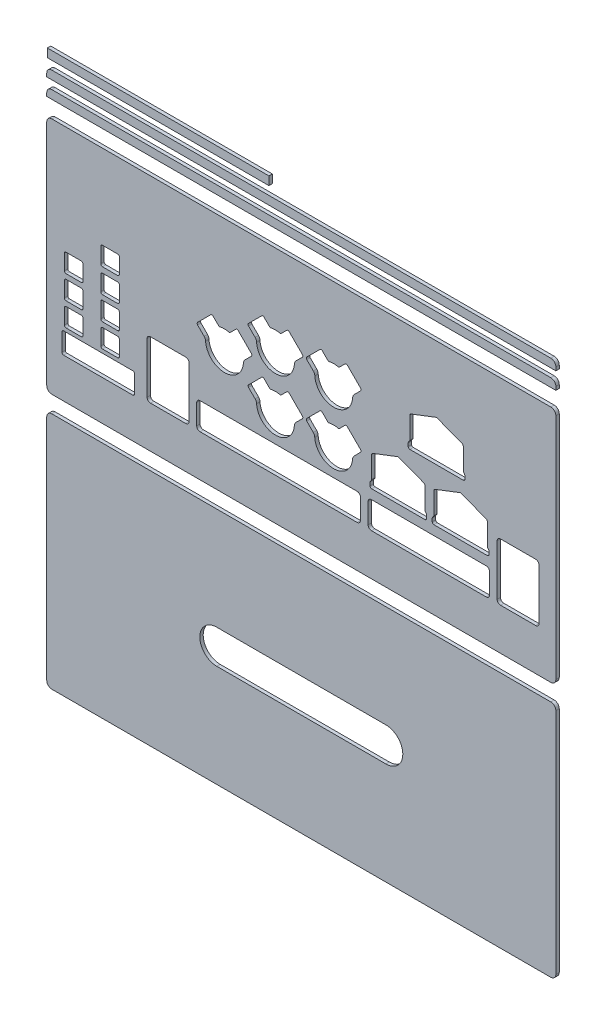
from build123d import *

# Parameters (mm, degrees)
SKETCH_1_W             = 301
SKETCH_1_H             = 141
SKETCH_1_W_2           = 11
SKETCH_1_H_2           = 11
SKETCH_1_W_3           = 42.882009629
SKETCH_1_H_3           = 12.463384351
EXTRUDE_1_DEPTH        = 2
FILLET_1_R             = 3
FILLET_2_R             = 1
SKETCH_2_W             = 301
SKETCH_2_H             = 5
EXTRUDE_2_DEPTH        = 2
FILLET_3_R             = 3
PATTERN_LINEAR_1_COUNT = 2
PATTERN_LINEAR_1_PITCH = 10
SKETCH_3_W             = 131
SKETCH_3_H             = 5
EXTRUDE_3_DEPTH        = 2
SKETCH_4_W             = 301
SKETCH_4_H             = 141
EXTRUDE_4_DEPTH        = 2
FILLET_4_R             = 3
CUT_EXTRUDE_1_DEPTH    = 2


with BuildPart() as part:
    # 草图1 → 凸台-拉伸1 (new body)
    with BuildSketch(Plane.XY):
        with Locations((145.5, 65.5)):
            Rectangle(SKETCH_1_W, SKETCH_1_H)
        with BuildLine():
            Line((107.479342602, 83.3954791), (103.152633216, 79.068769714))
            ThreePointArc((103.152633216, 79.068769714), (100.048889892, 79.525854826), (96.945146567, 79.068769714))
            Line((96.945146567, 79.068769714), (92.630133634, 83.383782646))
            Line((92.630133634, 83.383782646), (83.501399592, 74.255048604))
            Line((83.501399592, 74.255048604), (88.051647854, 69.704800341))
            ThreePointArc((88.051647854, 69.704800341), (88.68925935, 68.747618373), (88.908844178, 67.618668312))
            ThreePointArc((88.908844178, 67.618668312), (100.084096134, 57.15569059), (111.270007089, 67.607272058))
            ThreePointArc((111.270007089, 67.607272058), (111.532715847, 68.742609725), (112.190132556, 69.704800341))
            Line((112.190132556, 69.704800341), (116.680076959, 74.194744744))
            Line((116.680076959, 74.194744744), (107.479342602, 83.3954791))
        make_face(mode=Mode.SUBTRACT)
        with BuildLine():
            Line((137.61695402, 97.935247029), (133.290244634, 93.608537643))
            ThreePointArc((133.290244634, 93.608537643), (130.186501309, 94.065622755), (127.082757985, 93.608537643))
            Line((127.082757985, 93.608537643), (122.767745052, 97.923550576))
            Line((122.767745052, 97.923550576), (113.639011009, 88.794816533))
            Line((113.639011009, 88.794816533), (118.189259272, 84.24456827))
            ThreePointArc((118.189259272, 84.24456827), (118.826870768, 83.287386303), (119.046455596, 82.158436241))
            ThreePointArc((119.046455596, 82.158436241), (130.221707552, 71.695458519), (141.407618507, 82.147039988))
            ThreePointArc((141.407618507, 82.147039988), (141.670327265, 83.282377655), (142.327743974, 84.24456827))
            Line((142.327743974, 84.24456827), (146.817688376, 88.734512673))
            Line((146.817688376, 88.734512673), (137.61695402, 97.935247029))
        make_face(mode=Mode.SUBTRACT)
        with BuildLine():
            Line((172.054755422, 97.935247029), (167.728046035, 93.608537643))
            ThreePointArc((167.728046035, 93.608537643), (164.624302711, 94.065622755), (161.520559387, 93.608537643))
            Line((161.520559387, 93.608537643), (157.205546454, 97.923550576))
            Line((157.205546454, 97.923550576), (148.076812411, 88.794816533))
            Line((148.076812411, 88.794816533), (152.627060674, 84.24456827))
            ThreePointArc((152.627060674, 84.24456827), (153.26467217, 83.287386303), (153.484256998, 82.158436241))
            ThreePointArc((153.484256998, 82.158436241), (164.659508954, 71.695458519), (175.845419909, 82.147039988))
            ThreePointArc((175.845419909, 82.147039988), (176.108128666, 83.282377655), (176.765545376, 84.24456827))
            Line((176.765545376, 84.24456827), (181.255489778, 88.734512673))
            Line((181.255489778, 88.734512673), (172.054755422, 97.935247029))
        make_face(mode=Mode.SUBTRACT)
        with BuildLine():
            Line((172.008536395, 66.461273637), (167.681827008, 62.13456425))
            ThreePointArc((167.681827008, 62.13456425), (164.578083684, 62.591649363), (161.474340359, 62.13456425))
            Line((161.474340359, 62.13456425), (157.159327427, 66.449577183))
            Line((157.159327427, 66.449577183), (148.030593384, 57.32084314))
            Line((148.030593384, 57.32084314), (152.580841647, 52.770594878))
            ThreePointArc((152.580841647, 52.770594878), (153.218453142, 51.81341291), (153.43803797, 50.684462848))
            ThreePointArc((153.43803797, 50.684462848), (164.613289926, 40.221485126), (175.799200881, 50.673066595))
            ThreePointArc((175.799200881, 50.673066595), (176.061909639, 51.808404262), (176.719326348, 52.770594878))
            Line((176.719326348, 52.770594878), (181.209270751, 57.26053928))
            Line((181.209270751, 57.26053928), (172.008536395, 66.461273637))
        make_face(mode=Mode.SUBTRACT)
        with BuildLine():
            Line((137.61695402, 66.461273637), (133.290244634, 62.13456425))
            ThreePointArc((133.290244634, 62.13456425), (130.186501309, 62.591649363), (127.082757985, 62.13456425))
            Line((127.082757985, 62.13456425), (122.767745052, 66.449577183))
            Line((122.767745052, 66.449577183), (113.639011009, 57.32084314))
            Line((113.639011009, 57.32084314), (118.189259272, 52.770594878))
            ThreePointArc((118.189259272, 52.770594878), (118.826870768, 51.81341291), (119.046455596, 50.684462848))
            ThreePointArc((119.046455596, 50.684462848), (130.221707552, 40.221485126), (141.407618507, 50.673066595))
            ThreePointArc((141.407618507, 50.673066595), (141.670327265, 51.808404262), (142.327743974, 52.770594878))
            Line((142.327743974, 52.770594878), (146.817688376, 57.26053928))
            Line((146.817688376, 57.26053928), (137.61695402, 66.461273637))
        make_face(mode=Mode.SUBTRACT)
        Polygon((241.240019748, 90.803703673), (225.444911387, 96.887575353), (209.649803026, 90.803703673), (209.649803026, 77.052080268), (208.690506582, 75.840282178), (208.690506582, 72.632530051), (242.199316192, 72.632530051), (242.199316192, 75.840282178), (241.240019748, 77.052080268), align=None, mode=Mode.SUBTRACT)
        Polygon((218.625141178, 59.339189893), (202.830032817, 65.423061573), (187.034924456, 59.339189893), (187.034924456, 45.587566488), (186.075628012, 44.375768398), (186.075628012, 41.16801627), (219.584437622, 41.16801627), (219.584437622, 44.375768398), (218.625141178, 45.587566488), align=None, mode=Mode.SUBTRACT)
        Polygon((255.450830995, 59.339189893), (239.655722634, 65.423061573), (223.860614273, 59.339189893), (223.860614273, 45.587566488), (222.901317829, 44.375768398), (222.901317829, 41.16801627), (256.410127439, 41.16801627), (256.410127439, 44.375768398), (255.450830995, 45.587566488), align=None, mode=Mode.SUBTRACT)
        with Locations((32.437030163, 66.470141032)):
            Rectangle(SKETCH_1_W_2, SKETCH_1_H_2, mode=Mode.SUBTRACT)
        with BuildLine():
            Line((56.30337663, 53.628236384), (77.135061372, 53.628236384))
            ThreePointArc((77.135061372, 53.628236384), (78.549274934, 53.042449946), (79.135061372, 51.628236384))
            Line((79.135061372, 51.628236384), (79.135061372, 21.643814676))
            ThreePointArc((79.135061372, 21.643814676), (78.549274934, 20.229601113), (77.135061372, 19.643814676))
            Line((77.135061372, 19.643814676), (56.30337663, 19.643814676))
            ThreePointArc((56.30337663, 19.643814676), (54.889163068, 20.229601113), (54.30337663, 21.643814676))
            Line((54.30337663, 21.643814676), (54.30337663, 51.628236384))
            ThreePointArc((54.30337663, 51.628236384), (54.889163068, 53.042449946), (56.30337663, 53.628236384))
        make_face(mode=Mode.SUBTRACT)
        with BuildLine():
            Line((85.64105795, 35.56703416), (178.463172629, 35.56703416))
            ThreePointArc((178.463172629, 35.56703416), (179.877386192, 34.981247723), (180.463172629, 33.56703416))
            Line((180.463172629, 33.56703416), (180.463172629, 21.643814676))
            ThreePointArc((180.463172629, 21.643814676), (179.877386192, 20.229601113), (178.463172629, 19.643814676))
            Line((178.463172629, 19.643814676), (85.64105795, 19.643814676))
            ThreePointArc((85.64105795, 19.643814676), (84.226844388, 20.229601113), (83.64105795, 21.643814676))
            Line((83.64105795, 21.643814676), (83.64105795, 33.56703416))
            ThreePointArc((83.64105795, 33.56703416), (84.226844388, 34.981247723), (85.64105795, 35.56703416))
        make_face(mode=Mode.SUBTRACT)
        with BuildLine():
            Line((186.992635112, 35.56703416), (254.771670514, 35.56703416))
            ThreePointArc((254.771670514, 35.56703416), (256.185884076, 34.981247723), (256.771670514, 33.56703416))
            Line((256.771670514, 33.56703416), (256.771670514, 21.643814676))
            ThreePointArc((256.771670514, 21.643814676), (256.185884076, 20.229601113), (254.771670514, 19.643814676))
            Line((254.771670514, 19.643814676), (186.992635112, 19.643814676))
            ThreePointArc((186.992635112, 19.643814676), (185.578421549, 20.229601113), (184.992635112, 21.643814676))
            Line((184.992635112, 21.643814676), (184.992635112, 33.56703416))
            ThreePointArc((184.992635112, 33.56703416), (185.578421549, 34.981247723), (186.992635112, 35.56703416))
        make_face(mode=Mode.SUBTRACT)
        with BuildLine():
            Line((284.023192698, 53.585306134), (263.2536236, 53.585306134))
            ThreePointArc((263.2536236, 53.585306134), (261.839410038, 52.999519696), (261.2536236, 51.585306134))
            Line((261.2536236, 51.585306134), (261.2536236, 21.643814676))
            ThreePointArc((261.2536236, 21.643814676), (261.839410038, 20.229601113), (263.2536236, 19.643814676))
            Line((263.2536236, 19.643814676), (284.023192698, 19.643814676))
            ThreePointArc((284.023192698, 19.643814676), (285.43740626, 20.229601113), (286.023192698, 21.643814676))
            Line((286.023192698, 21.643814676), (286.023192698, 51.585306134))
            ThreePointArc((286.023192698, 51.585306134), (285.43740626, 52.999519696), (284.023192698, 53.585306134))
        make_face(mode=Mode.SUBTRACT)
        with Locations((10.937030163, 66.470141032)):
            Rectangle(SKETCH_1_W_2, SKETCH_1_H_2, mode=Mode.SUBTRACT)
        with Locations((10.937030163, 52.570141032)):
            Rectangle(SKETCH_1_W_2, SKETCH_1_H_2, mode=Mode.SUBTRACT)
        with Locations((10.937030163, 38.670141032)):
            Rectangle(SKETCH_1_W_2, SKETCH_1_H_2, mode=Mode.SUBTRACT)
        with Locations((32.437030163, 52.570141032)):
            Rectangle(SKETCH_1_W_2, SKETCH_1_H_2, mode=Mode.SUBTRACT)
        with Locations((32.437030163, 38.670141032)):
            Rectangle(SKETCH_1_W_2, SKETCH_1_H_2, mode=Mode.SUBTRACT)
        with Locations((32.437030163, 80.777013442)):
            Rectangle(SKETCH_1_W_2, SKETCH_1_H_2, mode=Mode.SUBTRACT)
        with Locations((25.396549479, 24.755667101)):
            Rectangle(SKETCH_1_W_3, SKETCH_1_H_3, mode=Mode.SUBTRACT)
    extrude(amount=-EXTRUDE_1_DEPTH)

    # 圆角1
    fillet_1_edges = [part.edges().sort_by_distance(p)[0] for p in [
        (296, 136, -1),
        (296, -5, -1),
        (-5, -5, -1),
        (-5, 136, -1),
    ]]
    fillet(fillet_1_edges, radius=FILLET_1_R)

    # 圆角2
    fillet_2_edges = [part.edges().sort_by_distance(p)[0] for p in [
        (103.152633216, 79.068769714, -1),
        (107.479342602, 83.3954791, -1),
        (116.680076959, 74.194744744, -1),
        (111.270007089, 67.607272058, -1),
        (88.908844178, 67.618668312, -1),
        (83.501399592, 74.255048604, -1),
        (92.630133634, 83.383782646, -1),
        (96.945146567, 79.068769714, -1),
        (133.290244634, 93.608537643, -1),
        (137.61695402, 97.935247029, -1),
        (146.817688376, 88.734512673, -1),
        (141.407618507, 82.147039988, -1),
        (119.046455596, 82.158436241, -1),
        (113.639011009, 88.794816533, -1),
        (122.767745052, 97.923550576, -1),
        (127.082757985, 93.608537643, -1),
        (167.728046035, 93.608537643, -1),
        (172.054755422, 97.935247029, -1),
        (181.255489778, 88.734512673, -1),
        (175.845419909, 82.147039988, -1),
        (153.484256998, 82.158436241, -1),
        (148.076812411, 88.794816533, -1),
        (157.205546454, 97.923550576, -1),
        (161.520559387, 93.608537643, -1),
        (167.681827008, 62.13456425, -1),
        (172.008536395, 66.461273637, -1),
        (181.209270751, 57.26053928, -1),
        (175.799200881, 50.673066595, -1),
        (153.43803797, 50.684462848, -1),
        (148.030593384, 57.32084314, -1),
        (157.159327427, 66.449577183, -1),
        (161.474340359, 62.13456425, -1),
        (133.290244634, 62.13456425, -1),
        (137.61695402, 66.461273637, -1),
        (146.817688376, 57.26053928, -1),
        (141.407618507, 50.673066595, -1),
        (119.046455596, 50.684462848, -1),
        (113.639011009, 57.32084314, -1),
        (122.767745052, 66.449577183, -1),
        (127.082757985, 62.13456425, -1),
        (241.240019748, 77.052080268, -1),
        (242.199316192, 75.840282178, -1),
        (242.199316192, 72.632530051, -1),
        (208.690506582, 72.632530051, -1),
        (208.690506582, 75.840282178, -1),
        (209.649803026, 77.052080268, -1),
        (209.649803026, 90.803703673, -1),
        (225.444911387, 96.887575353, -1),
        (241.240019748, 90.803703673, -1),
        (218.625141178, 45.587566488, -1),
        (219.584437622, 44.375768398, -1),
        (219.584437622, 41.16801627, -1),
        (186.075628012, 41.16801627, -1),
        (186.075628012, 44.375768398, -1),
        (187.034924456, 45.587566488, -1),
        (187.034924456, 59.339189893, -1),
        (202.830032817, 65.423061573, -1),
        (218.625141178, 59.339189893, -1),
        (255.450830995, 45.587566488, -1),
        (256.410127439, 44.375768398, -1),
        (256.410127439, 41.16801627, -1),
        (222.901317829, 41.16801627, -1),
        (222.901317829, 44.375768398, -1),
        (223.860614273, 45.587566488, -1),
        (223.860614273, 59.339189893, -1),
        (239.655722634, 65.423061573, -1),
        (255.450830995, 59.339189893, -1),
        (26.937030163, 71.970141032, -1),
        (37.937030163, 71.970141032, -1),
        (37.937030163, 60.970141032, -1),
        (26.937030163, 60.970141032, -1),
        (26.937030163, 86.277013442, -1),
        (37.937030163, 86.277013442, -1),
        (37.937030163, 75.277013442, -1),
        (26.937030163, 75.277013442, -1),
        (16.437030163, 71.970141032, -1),
        (16.437030163, 60.970141032, -1),
        (5.437030163, 60.970141032, -1),
        (16.437030163, 58.070141032, -1),
        (16.437030163, 47.070141032, -1),
        (5.437030163, 47.070141032, -1),
        (5.437030163, 58.070141032, -1),
        (16.437030163, 44.170141032, -1),
        (16.437030163, 33.170141032, -1),
        (5.437030163, 33.170141032, -1),
        (5.437030163, 44.170141032, -1),
        (37.937030163, 58.070141032, -1),
        (37.937030163, 47.070141032, -1),
        (26.937030163, 47.070141032, -1),
        (26.937030163, 58.070141032, -1),
        (37.937030163, 44.170141032, -1),
        (37.937030163, 33.170141032, -1),
        (26.937030163, 33.170141032, -1),
        (26.937030163, 44.170141032, -1),
        (3.955544665, 30.987359276, -1),
        (46.837554294, 30.987359276, -1),
        (46.837554294, 18.523974925, -1),
        (3.955544665, 18.523974925, -1),
        (5.437030163, 71.970141032, -1),
    ]]
    fillet(fillet_2_edges, radius=FILLET_2_R)


with BuildPart() as body_2:
    # 草图2 → 凸台-拉伸2 (new body)
    with BuildSketch(Plane.XY):
        with Locations((145.5, 148.5)):
            Rectangle(SKETCH_2_W, SKETCH_2_H)
    extrude(amount=-EXTRUDE_2_DEPTH)

    # 圆角3
    fillet_3_edges = [body_2.edges().sort_by_distance(p)[0] for p in [
        (-5, 151, -1),
        (296, 151, -1),
    ]]
    fillet(fillet_3_edges, radius=FILLET_3_R)


with BuildPart() as pattern_linear_1_1:
    # 阵列(线性)1: pattern copy
    add(body_2.part.moved(Location(Vector(0, 1, 0) * (1 * PATTERN_LINEAR_1_PITCH))))


with BuildPart() as body_4:
    # 草图3 → 凸台-拉伸3 (new body)
    with BuildSketch(Plane.XY):
        with Locations((60.862300303, 168.5)):
            Rectangle(SKETCH_3_W, SKETCH_3_H)
    extrude(amount=-EXTRUDE_3_DEPTH)


with BuildPart() as body_5:
    # 草图4 → 凸台-拉伸4 (new body)
    with BuildSketch(Plane.XY):
        with Locations((145.5, -85.5)):
            Rectangle(SKETCH_4_W, SKETCH_4_H)
    extrude(amount=-EXTRUDE_4_DEPTH)

    # 圆角4
    fillet_4_edges = [body_5.edges().sort_by_distance(p)[0] for p in [
        (-5, -156, -1),
        (296, -156, -1),
        (296, -15, -1),
        (-5, -15, -1),
    ]]
    fillet(fillet_4_edges, radius=FILLET_4_R)

    # 草图6 → 切除-拉伸1 (cut)
    with BuildSketch(Plane.XY):
        with BuildLine():
            Line((95.5, -75.5), (195.5, -75.5))
            ThreePointArc((195.5, -75.5), (205.5, -85.5), (195.5, -95.5))
            Line((195.5, -95.5), (95.5, -95.5))
            ThreePointArc((95.5, -95.5), (85.5, -85.5), (95.5, -75.5))
        make_face()
    extrude(amount=-CUT_EXTRUDE_1_DEPTH, mode=Mode.SUBTRACT)


solid = Compound([part.part, body_2.part, pattern_linear_1_1.part, body_4.part, body_5.part])
